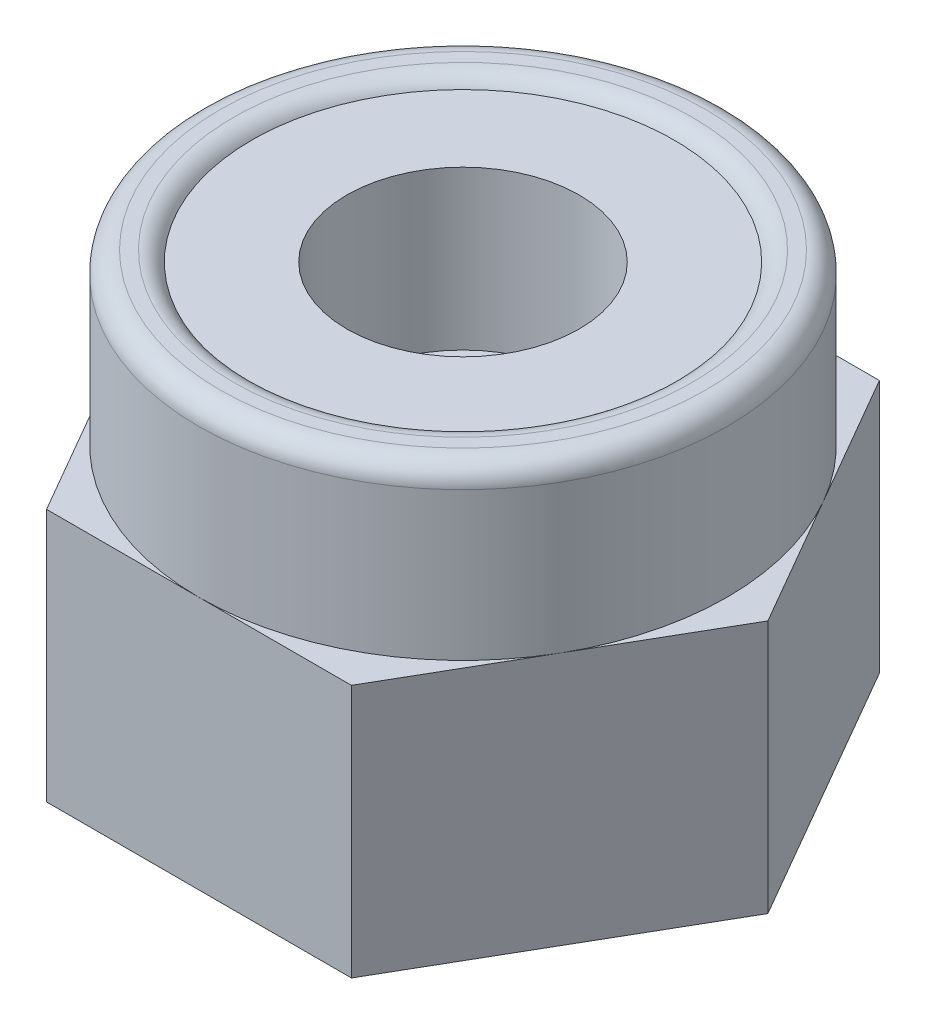
from build123d import *

# Parameters (mm, degrees)
CROQUIS1_R              = 1
SALIENTE_EXTRUIR1_DEPTH = 2.4
CROQUIS2_R              = 2.5
CROQUIS2_R_2            = 1.1
SALIENTE_EXTRUIR2_DEPTH = 1.6
CORTAR_EXTRUIR1_START   = -0.1
CROQUIS4_R              = 2
CROQUIS4_R_2            = 1.1
CORTAR_EXTRUIR1_DEPTH   = 0.1
REDONDEO1_R             = 0.2


with BuildPart() as part:
    # Croquis1 → Saliente-Extruir1 (new body)
    with BuildSketch(Plane(origin=(0, 0, 0), x_dir=(1, 0, 0), z_dir=(0, 1, 0))):
        Polygon((-1.443375673, 2.5), (-2.886751346, 0), (-1.443375673, -2.5), (1.443375673, -2.5), (2.886751346, 0), (1.443375673, 2.5), align=None)
        with Locations(Location((0, 0, 0), (0, 0, 270))):
            Circle(CROQUIS1_R, mode=Mode.SUBTRACT)
    extrude(amount=SALIENTE_EXTRUIR1_DEPTH)

    # Croquis2 → Saliente-Extruir2 (add)
    with BuildSketch(Plane(origin=(0, 2.4, 0), x_dir=(1, 0, 0), z_dir=(0, 1, 0))):
        with Locations(Location((0, 0, 0), (0, 0, 270))):
            Circle(CROQUIS2_R)
        with Locations(Location((0, 0, 0), (0, 0, 270))):
            Circle(CROQUIS2_R_2, mode=Mode.SUBTRACT)
    extrude(amount=SALIENTE_EXTRUIR2_DEPTH)

    # Croquis4 → Cortar-Extruir1 (cut)
    with BuildSketch(Plane(origin=(0, 4, 0), x_dir=(1, 0, 0), z_dir=(0, 1, 0)).offset(CORTAR_EXTRUIR1_START)):
        with Locations(Location((0, 0, 0), (0, 0, 270))):
            Circle(CROQUIS4_R)
        with Locations(Location((0, 0, 0), (0, 0, 270))):
            Circle(CROQUIS4_R_2, mode=Mode.SUBTRACT)
    extrude(amount=CORTAR_EXTRUIR1_DEPTH, mode=Mode.SUBTRACT)

    # Redondeo1
    # the kernel refuses this fillet: 0.2 mm, written as the material it takes off along each edge
    with BuildSketch(Plane(origin=(0, 4, 0), x_dir=(0, 0, 1), z_dir=(-1, 0, 0))) as redondeo1_piece_1:
        with BuildLine():
            CenterArc((2.5 - REDONDEO1_R, -REDONDEO1_R), REDONDEO1_R, 0, 90)
            Line((2.5 - REDONDEO1_R, 0), (2.5 - REDONDEO1_R, REDONDEO1_R * 0.02))
            Line((2.5 - REDONDEO1_R, REDONDEO1_R * 0.02), (2.5 + REDONDEO1_R * 0.02, REDONDEO1_R * 0.02))
            Line((2.5 + REDONDEO1_R * 0.02, REDONDEO1_R * 0.02), (2.5 + REDONDEO1_R * 0.02, -REDONDEO1_R))
            Line((2.5 + REDONDEO1_R * 0.02, -REDONDEO1_R), (2.5, -REDONDEO1_R))
        make_face()
    revolve(axis=Axis((0, 4, 0), (0, 1, 0)), mode=Mode.SUBTRACT)
    with BuildSketch(Plane(origin=(0, 4, 0), x_dir=(0, 0, 1), z_dir=(-1, 0, 0))) as redondeo1_piece_2:
        with BuildLine():
            CenterArc((2.173205081, -0.2), REDONDEO1_R, 90, 60)
            Line((2, -0.1), (1.996535898, -0.098))
            ThreePointArc((1.996535898, -0.098), (1.996, -0.05), (1.996, 0))
            Line((1.996, 0), (2, 0.004))
            Line((2, 0.004), (2.173205081, 0.004))
            Line((2.173205081, 0.004), (2.173205081, 0))
        make_face()
    revolve(axis=Axis((0, 4, 0), (0, 1, 0)), mode=Mode.SUBTRACT)


solid = part.part
